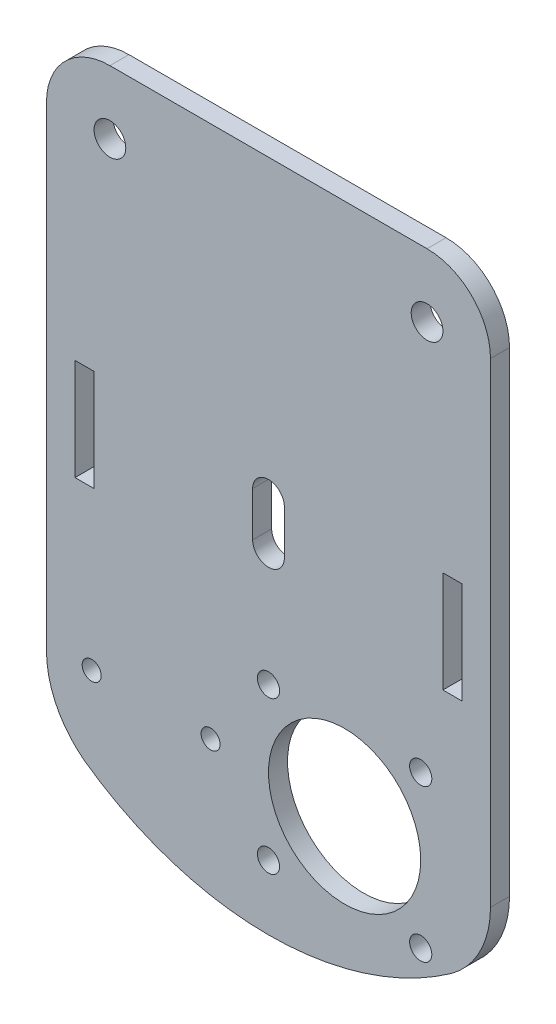
from build123d import *

# Parameters (mm, degrees)
SKETCH1_R           = 2.5
BOSS_EXTRUDE1_DEPTH = 3
FILLET1_R           = 10
FILLET1_R_2         = 15
FILLET1_R_3         = 50
SKETCH2_R           = 1.75
SKETCH2_R_2         = 12
CUT_EXTRUDE1_DEPTH  = 84.903310475
SKETCH4_W           = 3
SKETCH4_H           = 16
CUT_EXTRUDE3_DEPTH  = 84.903310475
SKETCH9_R           = 1.5
CUT_EXTRUDE4_DEPTH  = 84.903310475


with BuildPart() as part:
    # Sketch1 → Boss-Extrude1 (new body)
    with BuildSketch(Plane.XY):
        Polygon((-35, 30), (35, 30), (35, -62.640754554), (0, -87.640754554), (-35, -62.640754554), align=None)
        with Locations((25, 20)):
            Circle(SKETCH1_R, mode=Mode.SUBTRACT)
        with Locations((-25, 20)):
            Circle(SKETCH1_R, mode=Mode.SUBTRACT)
        with BuildLine():
            Line((2.5, -16.5), (2.5, -23.5))
            ThreePointArc((2.5, -23.5), (0, -26), (-2.5, -23.5))
            Line((-2.5, -23.5), (-2.5, -16.5))
            ThreePointArc((-2.5, -16.5), (0, -14), (2.5, -16.5))
        make_face(mode=Mode.SUBTRACT)
    extrude(amount=BOSS_EXTRUDE1_DEPTH)

    # Fillet1
    # the kernel refuses this fillet: 50, 15, 10 mm, written as the material it takes off along each edge
    with BuildSketch(Plane(origin=(35, 30, -25), x_dir=(-1, 0, 0), z_dir=(0, 0, 1))) as fillet1_piece_1:
        with BuildLine():
            CenterArc((FILLET1_R, FILLET1_R), FILLET1_R, 180, 90)
            Line((0, FILLET1_R), (0, 0))
            Line((0, 0), (FILLET1_R, 0))
        make_face()
    extrude(amount=53, mode=Mode.SUBTRACT)
    with BuildSketch(Plane(origin=(-35, 30, -25), x_dir=(1, 0, 0), z_dir=(0, 0, 1))) as fillet1_piece_2:
        with BuildLine():
            CenterArc((FILLET1_R, -FILLET1_R), FILLET1_R, 90, 90)
            Line((0, -FILLET1_R), (0, 0))
            Line((0, 0), (FILLET1_R, 0))
        make_face()
    extrude(amount=53, mode=Mode.SUBTRACT)
    with BuildSketch(Plane(origin=(-35, -62.640754554, -19.298171073), x_dir=(0.8137334712067342, -0.5812381937190976, 0), z_dir=(0, 0, 1)), Plane(origin=(35, -62.640754554, -19.298171073), x_dir=(0, 1, 0), z_dir=(0, 0, 1))) as fillet1_piece_3:
        with BuildLine():
            CenterArc((FILLET1_R_2 * 0.514617895292, FILLET1_R_2), FILLET1_R_2, 215.537677792, 54.462322208)
            Line((-FILLET1_R_2 * 0.299115575915, FILLET1_R_2 * 0.418761806281), (0, 0))
            Line((0, 0), (FILLET1_R_2 * 0.514617895292, 0))
        make_face()
    extrude(amount=41.596342147, mode=Mode.SUBTRACT)
    with BuildSketch(Plane(origin=(0, -87.640754554, -89.285714286), x_dir=(0.8137334712067352, 0.5812381937190962, 0), z_dir=(0, 0, 1))) as fillet1_piece_4:
        with BuildLine():
            CenterArc((FILLET1_R_3 * 0.714285714286, FILLET1_R_3), FILLET1_R_3, 198.924644416, 71.075355584)
            Line((-FILLET1_R_3 * 0.23166023166, FILLET1_R_3 * 0.675675675676), (0, 0))
            Line((0, 0), (FILLET1_R_3 * 0.714285714286, 0))
        make_face()
    extrude(amount=181.571428571, mode=Mode.SUBTRACT)

    # Sketch2 → Cut-Extrude1 (cut, through all)
    with BuildSketch(Plane.XY.offset(3)):
        with Locations((24, -42)):
            Circle(SKETCH2_R)
        with Locations((0, -42)):
            Circle(SKETCH2_R)
        with Locations((0, -66)):
            Circle(SKETCH2_R)
        with Locations((24, -66)):
            Circle(SKETCH2_R)
        with Locations((12, -54)):
            Circle(SKETCH2_R_2)
    extrude(amount=-CUT_EXTRUDE1_DEPTH, mode=Mode.SUBTRACT)

    # Sketch4 → Cut-Extrude3 (cut, through all)
    with BuildSketch(Plane.XY.offset(3)):
        with Locations((29, -21)):
            Rectangle(SKETCH4_W, SKETCH4_H)
        with Locations((-29, -21)):
            Rectangle(SKETCH4_W, SKETCH4_H)
    extrude(amount=-CUT_EXTRUDE3_DEPTH, mode=Mode.SUBTRACT)

    # Sketch9 → Cut-Extrude4 (cut, through all)
    with BuildSketch(Plane.XY.offset(3)):
        with Locations((-27.875, -54)):
            Circle(SKETCH9_R)
        with Locations((-9.125, -54)):
            Circle(SKETCH9_R)
    extrude(amount=-CUT_EXTRUDE4_DEPTH, mode=Mode.SUBTRACT)


solid = part.part
